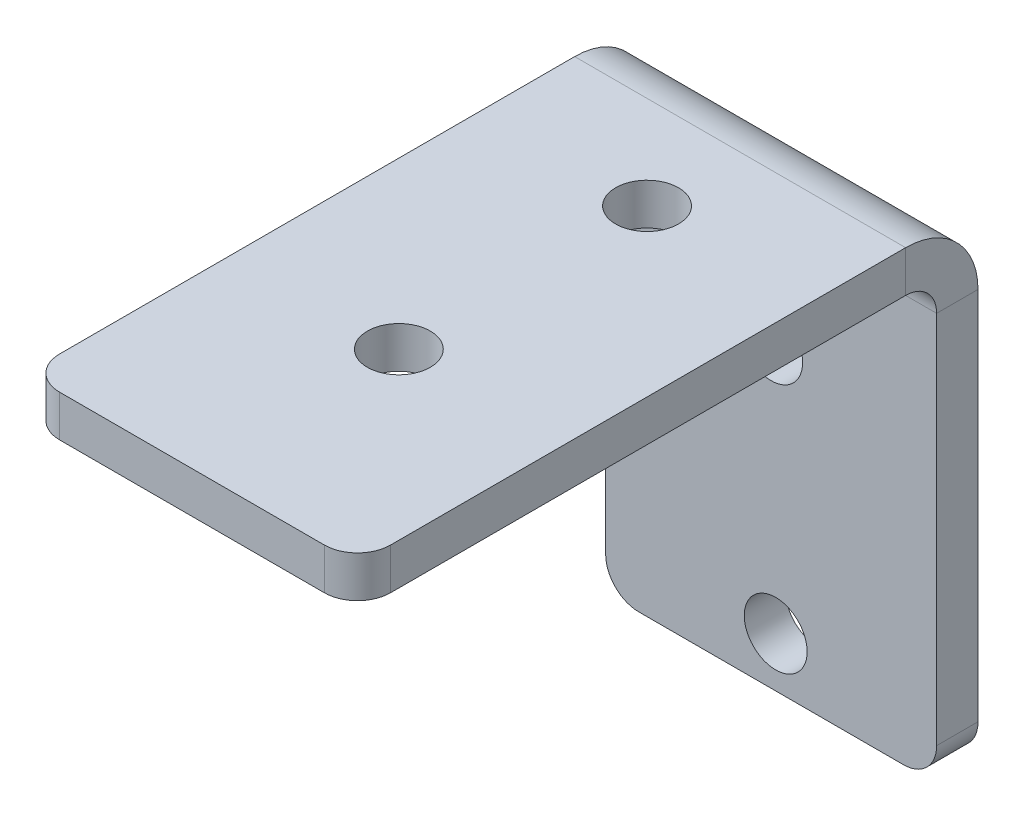
from build123d import *

# Parameters (mm, degrees)
SKETCH1_W              = 25.4
SKETCH1_H              = 36.83
SKETCH1_R              = 2.413
BOSS_EXTRUDE1_DEPTH    = 3.175
SKETCH2_W              = 25.4
SKETCH2_H              = 3.175
BOSS_EXTRUDE2_DEPTH    = 44.45
SKETCH3_R              = 2.413
CUT_EXTRUDE1_DEPTH     = 44.45
FILLET1_R              = 2.54
CONVERT_SOLID1_START   = -12.7
CONVERT_SOLID1_DEPTH   = 25.4
CONVERT_SOLID1_2_DEPTH = 25.4


# Read off the part's stored shape, not the designer's step: Convert-Solid1
with BuildPart() as part:
    # Sketch1 → Boss-Extrude1 (new body)
    with BuildSketch(Plane.XY):
        Rectangle(SKETCH1_W, SKETCH1_H)
        with Locations((0, 4.445)):
            Circle(SKETCH1_R, mode=Mode.SUBTRACT)
        with Locations((0.348627451, -14.605)):
            Circle(SKETCH1_R, mode=Mode.SUBTRACT)
    extrude(amount=BOSS_EXTRUDE1_DEPTH)

    # Sketch2 → Boss-Extrude2 (add)
    with BuildSketch(Plane.XY.offset(3.175)):
        with Locations((0, 16.8275)):
            Rectangle(SKETCH2_W, SKETCH2_H)
    extrude(amount=BOSS_EXTRUDE2_DEPTH)

    # Sketch3 → Cut-Extrude1 (cut)
    with BuildSketch(Plane(origin=(0, 18.415, 0), x_dir=(1, 0, 0), z_dir=(0, 1, 0))):
        with Locations(Location((0, -12.7, 0), (0, 0, 270))):
            Circle(SKETCH3_R)
        with Locations(Location((0, -31.75, 0), (0, 0, 270))):
            Circle(SKETCH3_R)
    extrude(amount=-CUT_EXTRUDE1_DEPTH, mode=Mode.SUBTRACT)

    # Fillet1
    fillet1_edges = [part.edges().sort_by_distance(p)[0] for p in [
        (-12.7, 16.8275, 47.625),
        (12.7, 16.8275, 47.625),
        (12.7, -18.415, 1.5875),
        (-12.7, -18.415, 1.5875),
    ]]
    fillet(fillet1_edges, radius=FILLET1_R)

    # Convert-Solid1 outline → Convert-Solid1 (cut)
    with BuildSketch(Plane.YZ.offset(CONVERT_SOLID1_START)):
        with BuildLine():
            Line((18.415, 0), (18.415, 5.555000066))
            ThreePointArc((18.415, 5.555000066), (16.78797815, 1.62702185), (12.859999934, 0))
            Line((12.859999934, 0), (18.415, 0))
        make_face()
    extrude(amount=CONVERT_SOLID1_DEPTH, mode=Mode.SUBTRACT)

    # Convert-Solid1 2 outline → Convert-Solid1 2 (add)
    with BuildSketch(Plane.YZ.offset(CONVERT_SOLID1_START)):
        with BuildLine():
            Line((15.24, 3.175), (15.24, 5.555000066))
            ThreePointArc((15.24, 5.555000066), (14.54291412, 3.87208588), (12.859999934, 3.175))
            Line((12.859999934, 3.175), (15.24, 3.175))
        make_face()
    extrude(amount=CONVERT_SOLID1_2_DEPTH)


solid = part.part
